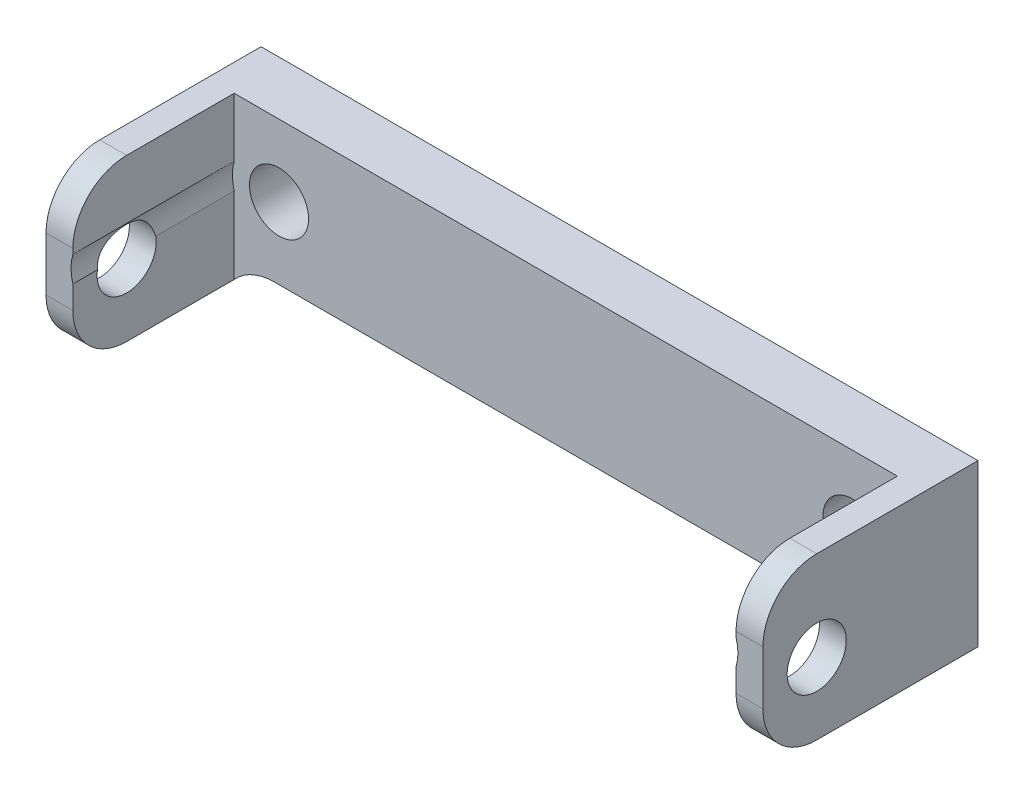
from build123d import *

# Parameters (mm, degrees)
ESBO_O1_W                = 40
ESBO_O1_H                = 8
ESBO_O1_R                = 1.65
RESSALTO_EXTRUS_O1_DEPTH = 3
ESBO_O2_W                = 12
ESBO_O2_H                = 9
ESBO_O2_R                = 1.65
RESSALTO_EXTRUS_O2_DEPTH = 1.5
FILETE2_R                = 3
CORTE_EXTRUS_O1_REACH    = 25.854
ESBO_O3_R                = 2.6
ESPELHAR1_START          = 18.5
ESPELHAR1_OUTLINE_R      = 1.65
ESPELHAR1_DEPTH          = 1.5
ESPELHAR1_START_2        = 16.263932023
ESPELHAR1_2_OUTLINE_W    = 1
ESPELHAR1_2_OUTLINE_H    = 3
ESPELHAR1_2_DEPTH        = 2.236067977
ESPELHAR1_START_3        = -1
ESPELHAR1_3_DEPTH        = 4.84942
ESPELHAR1_START_4        = 3
ESPELHAR1_4_DEPTH        = 10


with BuildPart() as part:
    # Esboço1 → Ressalto-extrusão1 (new body)
    with BuildSketch(Plane.XY):
        Rectangle(ESBO_O1_W, ESBO_O1_H)
        with Locations((-16, 0)):
            Circle(ESBO_O1_R, mode=Mode.SUBTRACT)
        with Locations(Location((16, 0, 0), (0, 0, 180))):
            Circle(ESBO_O1_R, mode=Mode.SUBTRACT)
    extrude(amount=RESSALTO_EXTRUS_O1_DEPTH)

    # Esboço2 → Ressalto-extrusão2 (add)
    with BuildSketch(Plane.ZY.offset(20)):
        with Locations((6, -0.5)):
            Rectangle(ESBO_O2_W, ESBO_O2_H)
        with Locations((9, -1)):
            Circle(ESBO_O2_R, mode=Mode.SUBTRACT)
    extrude(amount=-RESSALTO_EXTRUS_O2_DEPTH)

    # Filete2
    # the kernel refuses this fillet: 3 mm, written as the material it adds along each edge
    with BuildSketch(Plane(origin=(-18.5, -4, 3), x_dir=(1, 0, 0), z_dir=(0, 0, -1))) as filete2_piece_1:
        with BuildLine():
            CenterArc((2.236067977, 3), FILETE2_R, 221.810314896, 48.189685104)
            Line((0, 1), (0, 0))
            Line((0, 0), (2.236067977, 0))
        make_face()
    extrude(amount=3)
    # the kernel refuses this fillet: 3 mm, written as the material it takes off along each edge
    with BuildSketch(Plane(origin=(-27.5, -5, 12), x_dir=(0, 0, -1), z_dir=(1, 0, 0))) as filete2_2_piece_1:
        with BuildLine():
            CenterArc((FILETE2_R, FILETE2_R), FILETE2_R, 180, 90)
            Line((0, FILETE2_R), (0, 0))
            Line((0, 0), (FILETE2_R, 0))
        make_face()
    extrude(amount=16.5, mode=Mode.SUBTRACT)
    with BuildSketch(Plane(origin=(-27.5, 4, 12), x_dir=(0, 0, -1), z_dir=(1, 0, 0))) as filete2_2_piece_2:
        with BuildLine():
            CenterArc((FILETE2_R, -FILETE2_R), FILETE2_R, 90, 90)
            Line((0, -FILETE2_R), (0, 0))
            Line((0, 0), (FILETE2_R, 0))
        make_face()
    extrude(amount=16.5, mode=Mode.SUBTRACT)

    # Corte-extrusão1: up to this face of the body (flat: up to its plane)
    corte_extrus_o1_end = Plane(part.part.faces().sort_by_distance((0.749892581, -0.010110038, 3))[0])
    # Esboço3 → Corte-extrusão1 (cut, up to the picked face)
    with BuildSketch(Plane.XY.offset(12), mode=Mode.PRIVATE) as corte_extrus_o1_sk1:
        with Locations((-16, 0)):
            Circle(ESBO_O3_R)
    corte_extrus_o1_tool1 = split(extrude(corte_extrus_o1_sk1.sketch, amount=-CORTE_EXTRUS_O1_REACH, mode=Mode.PRIVATE), bisect_by=corte_extrus_o1_end, keep=Keep.BOTH, mode=Mode.PRIVATE)
    add(corte_extrus_o1_tool1.solids().sort_by(Axis((-16, 0, 12), (0, 0, -1)))[0], mode=Mode.SUBTRACT)

    # Espelhar1: read off the stored shape, not the designer's step
    # Espelhar1 outline → Espelhar1 (add)
    with BuildSketch(Plane.YZ.offset(ESPELHAR1_START)):
        with BuildLine():
            Line((1, 12), (-2, 12))
            ThreePointArc((-2, 12), (-4.121320344, 11.121320344), (-5, 9))
            Line((-5, 9), (-5, 0))
            Line((-5, 0), (-4, 0))
            Line((-4, 0), (-4, 3))
            Line((-4, 3), (4, 3))
            Line((4, 3), (4, 9))
            ThreePointArc((4, 9), (3.121320344, 11.121320344), (1, 12))
        make_face()
        with Locations((-1, 9)):
            Circle(ESPELHAR1_OUTLINE_R, mode=Mode.SUBTRACT)
    extrude(amount=ESPELHAR1_DEPTH)

    # Espelhar1 2 outline → Espelhar1 2 (add)
    with BuildSketch(Plane.YZ.offset(ESPELHAR1_START_2)):
        with Locations((-4.5, 1.5)):
            Rectangle(ESPELHAR1_2_OUTLINE_W, ESPELHAR1_2_OUTLINE_H)
    extrude(amount=ESPELHAR1_2_DEPTH)

    # Espelhar1 3 outline → Espelhar1 3 (cut)
    with BuildSketch(Plane.XY.offset(ESPELHAR1_START_3)):
        with BuildLine():
            Line((16.263932023, -5), (18.5, -5))
            ThreePointArc((18.5, -5), (17.488676894, -4.261387212), (16.263932023, -4))
            Line((16.263932023, -4), (16.263932023, -5))
        make_face()
    extrude(amount=ESPELHAR1_3_DEPTH, mode=Mode.SUBTRACT)

    # Espelhar1 4 outline → Espelhar1 4 (cut)
    with BuildSketch(Plane.XY.offset(ESPELHAR1_START_4)):
        with BuildLine():
            Line((18.5, 0.714142843), (18.5, -0.714142843))
            ThreePointArc((18.5, -0.714142843), (18.6, 0), (18.5, 0.714142843))
        make_face()
    extrude(amount=ESPELHAR1_4_DEPTH, mode=Mode.SUBTRACT)


solid = part.part
